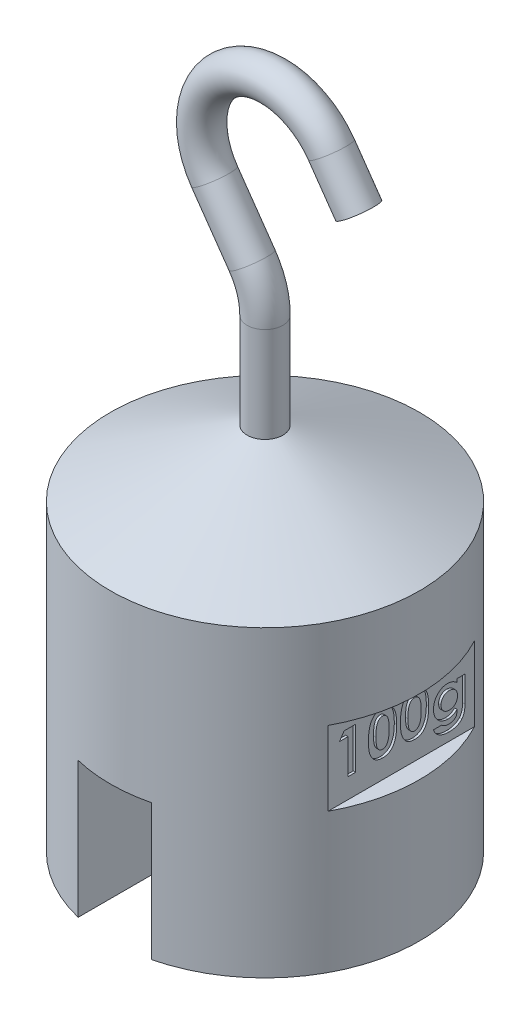
from build123d import *

# Parameters (mm, degrees)
SKETCH1_R               = 13
BOSS_EXTRUDE1_DEPTH     = 25.5
CUT_EXTRUDE1_DEPTH      = 32.436443819
CUT_EXTRUDE1_DEPTH_BACK = 32.436443819
SKETCH3_W               = 6.16
SKETCH3_H               = 11.43
SKETCH4_R               = 1.525
BOSS_EXTRUDE2_DEPTH     = 4.15
SWEEP1_START            = -20.06554348
SWEEP1_OUTLINE_R        = 1.5
SWEEP1_DEPTH            = 4.0000001
SWEEP1_START_2          = -16.06554338
SWEEP1_2_OUTLINE_R      = 1.5
SWEEP1_2_DEPTH          = 1.5
SWEEP1_3_OUTLINE_R      = 1.5
SWEEP1_3_ANGLE          = 35
SWEEP1_4_OUTLINE_R      = 1.5
SWEEP1_4_ANGLE          = 180
SWEEP1_START_3          = 5
SWEEP1_5_OUTLINE_R      = 1.5
SWEEP1_5_DEPTH          = 8.5800001
CUT_EXTRUDE4_DEPTH      = 38.312028765
CUT_EXTRUDE4_DEPTH_BACK = 38.312028765
SKETCH6_W               = 1.55
SKETCH6_H               = 6.25
CUT_EXTRUDE5_DEPTH      = 0.2


with BuildPart() as part:
    # Sketch1 → Boss-Extrude1 (new body)
    with BuildSketch(Plane(origin=(0, 0, 0), x_dir=(1, 0, 0), z_dir=(0, 1, 0))):
        with Locations(Location((0, 0, 0), (0, 0, 270))):
            Circle(SKETCH1_R)
    extrude(amount=-BOSS_EXTRUDE1_DEPTH)

    # Sketch2 → Revolve2 (revolve)
    with BuildSketch(Plane.XY, mode=Mode.PRIVATE) as revolve2_sk:
        Polygon((-1.5, 5.58), (-13, 0), (0, 0), (0, 5.58), align=None)
    revolve(revolve2_sk.sketch.rotate(Axis((0, 16.429455781, 0), (0, -1, 0)), 90), axis=Axis((0, 16.429455781, 0), (0, -1, 0)))

    # Sketch3 → Cut-Extrude1 (cut, two sides: drawn at the far end of the back side and taken through both)
    with BuildSketch(Plane.XY.offset(-CUT_EXTRUDE1_DEPTH_BACK)):
        with Locations((0, -19.785)):
            Rectangle(SKETCH3_W, SKETCH3_H)
    extrude(amount=CUT_EXTRUDE1_DEPTH + CUT_EXTRUDE1_DEPTH_BACK, mode=Mode.SUBTRACT)

    # Sketch4 → Boss-Extrude2 (add, symmetric)
    with BuildSketch(Plane(origin=(0, 0, 0), x_dir=(0, 0, -1), z_dir=(1, 0, 0))):
        with Locations(Location((0, -21.235, 0), (0, 0, 180))):
            Circle(SKETCH4_R)
    extrude(amount=BOSS_EXTRUDE2_DEPTH, both=True)



with BuildPart() as body_2:
    # Sweep1: read off the stored shape, not the designer's step
    # Sweep1 outline → Sweep1 (new body)
    with BuildSketch(Plane(origin=(0, 0, 0), x_dir=(0.8191520442889926, 0.5735764363510448, 0), z_dir=(0.5735764363510448, -0.8191520442889927, 0)).offset(SWEEP1_START)):
        with Locations((8.87425574, 0)):
            Circle(SWEEP1_OUTLINE_R)
        with Locations((20.87425574, 0)):
            Circle(SWEEP1_OUTLINE_R)
    extrude(amount=SWEEP1_DEPTH)

    # Sweep1 2 outline → Sweep1 2 (add)
    with BuildSketch(Plane(origin=(0, 0, 0), x_dir=(0.8191520442889926, 0.5735764363510448, 0), z_dir=(0.5735764363510448, -0.8191520442889927, 0)).offset(SWEEP1_START_2)):
        with Locations((8.87425574, 0)):
            Circle(SWEEP1_2_OUTLINE_R)
    extrude(amount=SWEEP1_2_DEPTH)

    # Sweep1 3 outline → Sweep1 3 (revolve)
    with BuildSketch(Plane(origin=(-6, 13.58, 0), x_dir=(1, 0, 0), z_dir=(0, -1, 0))):
        with Locations((6, 0)):
            Circle(SWEEP1_3_OUTLINE_R)
    revolve(axis=Axis((-6, 13.58, 0), (0, 0, 1)), revolution_arc=SWEEP1_3_ANGLE)

    # Sweep1 4 outline → Sweep1 4 (revolve)
    with BuildSketch(Plane(origin=(0.675154132, 24.96825348, 0), x_dir=(0.819152044288995, 0.5735764363510415, 0), z_dir=(0.5735764363510415, -0.819152044288995, 0))):
        with Locations((6, 0)):
            Circle(SWEEP1_4_OUTLINE_R)
    revolve(axis=Axis((0.675154132, 24.96825348, 0), (0, 0, 1)), revolution_arc=SWEEP1_4_ANGLE)


with BuildPart() as part_1:
    add(part.part)

    add(body_2.part)  # Sweep1 5 merges body 2
    # Sweep1 5 outline → Sweep1 5 (add)
    with BuildSketch(Plane(origin=(0, 0, 0), x_dir=(1, 0, 0), z_dir=(0, 1, 0)).offset(SWEEP1_START_3)):
        Circle(SWEEP1_5_OUTLINE_R)
    extrude(amount=SWEEP1_5_DEPTH)

    # Sketch6 → Cut-Extrude4 (cut, two sides: drawn at the far end of the back side and taken through both)
    with BuildSketch(Plane.XY.offset(-CUT_EXTRUDE4_DEPTH_BACK)):
        with Locations((12.225, -10.625)):
            Rectangle(SKETCH6_W, SKETCH6_H)
    extrude(amount=CUT_EXTRUDE4_DEPTH + CUT_EXTRUDE4_DEPTH_BACK, mode=Mode.SUBTRACT)

    # Sketch9 → Cut-Extrude5 (cut)
    # profile 1 of 4: a face of its own
    with BuildSketch(Plane(origin=(11.45, 0, 0), x_dir=(0, 0, -1), z_dir=(1, 0, 0))):
        Polygon((-4.803827401, -8.573958386), (-3.832773716, -8.573958386), (-3.832773716, -12.073958386), (-4.460978844, -12.073958386), (-4.460978844, -9.157291719), (-5.178927562, -9.157291719), align=None)
    # profile 2 of 4: a face of its own
    with BuildSketch(Plane(origin=(11.45, 0, 0), x_dir=(0, 0, -1), z_dir=(1, 0, 0))):
        with BuildLine():
            add(Edge.make_bspline(
                [(-1.577264901, -8.484214796), (-1.546857166, -8.484666208), (-1.487067433, -8.485553803), (-1.399008412, -8.495167185), (-1.314183228, -8.509690323), (-1.232260033, -8.529945037), (-1.153828521, -8.556751429), (-1.07831785, -8.588838221), (-1.006626815, -8.62788843), (-0.937841127, -8.671997648), (-0.871987283, -8.721935536), (-0.810648032, -8.778867306), (-0.752703191, -8.841482956), (-0.699407051, -8.910729123), (-0.649579354, -8.985975939), (-0.603383824, -9.067235336), (-0.5611741, -9.154905025), (-0.522477112, -9.249143212), (-0.487874143, -9.351362487), (-0.458728106, -9.462735349), (-0.433730501, -9.583287233), (-0.412630759, -9.71331821), (-0.396682765, -9.853001122), (-0.385933495, -10.002243172), (-0.378556838, -10.160756642), (-0.377954806, -10.26949558), (-0.37764551, -10.32536063)],
                knots=[0, 0, 0, 0, 0.879237366, 1.728815576, 2.559023295, 3.367336655, 4.166867292, 4.954216142, 5.737608147, 6.525189134, 7.316157332, 8.124696809, 8.942788509, 9.781158001, 10.649253743, 11.551476218, 12.482711956, 13.461909668, 14.496590415, 15.601789533, 16.789733467, 18.056700938, 19.410929216, 20.8549011, 22.384193279, 24, 24, 24, 24], degree=3))
            add(Edge.make_bspline(
                [(-0.37764551, -10.32536063), (-0.377979776, -10.381924614), (-0.378629247, -10.491827421), (-0.385626845, -10.651790736), (-0.39767704, -10.802116372), (-0.4132082, -10.942788778), (-0.434481642, -11.073733667), (-0.459395799, -11.195290097), (-0.489001898, -11.307414008), (-0.524744677, -11.409852761), (-0.563207432, -11.504256451), (-0.605532617, -11.591755205), (-0.650982512, -11.672586017), (-0.698514632, -11.747968331), (-0.750734863, -11.815679915), (-0.8051015, -11.878023315), (-0.863981762, -11.932623793), (-0.924896564, -11.982295211), (-0.99007746, -12.025221284), (-1.058852258, -12.06276372), (-1.132447092, -12.093215095), (-1.209520454, -12.119700074), (-1.291386075, -12.138713432), (-1.376743121, -12.153799906), (-1.466555257, -12.162137617), (-1.527702976, -12.163171965), (-1.559035735, -12.163701976)],
                knots=[0, 0, 0, 0, 1.643780988, 3.193836972, 4.651895693, 6.025988579, 7.305620092, 8.505800249, 9.631074763, 10.672816429, 11.65661981, 12.592235626, 13.49536222, 14.350718032, 15.179365177, 15.97804903, 16.751647189, 17.51006938, 18.259804725, 19.016521909, 19.783502495, 20.571750527, 21.382245291, 22.22305063, 23.089471752, 24, 24, 24, 24], degree=3))
            add(Edge.make_bspline(
                [(-1.559035735, -12.163701976), (-1.590367648, -12.163161741), (-1.651746404, -12.162103429), (-1.741801401, -12.1538619), (-1.827610797, -12.138652316), (-1.910124106, -12.119554104), (-1.98876705, -12.093273696), (-2.063916718, -12.061911238), (-2.134995275, -12.024603048), (-2.202199526, -11.981576961), (-2.265300016, -11.932237882), (-2.325277328, -11.877113548), (-2.381998787, -11.816343685), (-2.434601519, -11.749247621), (-2.483947006, -11.676720947), (-2.529520651, -11.597935445), (-2.571295067, -11.513005825), (-2.610576964, -11.421813702), (-2.64470796, -11.322395816), (-2.675082962, -11.213864377), (-2.699965365, -11.095314686), (-2.719977458, -10.966784829), (-2.735955101, -10.828547101), (-2.747840632, -10.68053478), (-2.754877098, -10.522678924), (-2.755519759, -10.414176732), (-2.755850639, -10.358313354)],
                knots=[0, 0, 0, 0, 0.917216111, 1.796812873, 2.643793957, 3.46689424, 4.273913431, 5.068098542, 5.848489301, 6.620921603, 7.401012384, 8.190319798, 9.003608147, 9.831726257, 10.68377682, 11.569763213, 12.493818149, 13.453288342, 14.474581811, 15.568529029, 16.750744269, 18.018426408, 19.375425659, 20.823733699, 22.36466933, 24, 24, 24, 24], degree=3))
            add(Edge.make_bspline(
                [(-2.755850639, -10.358313354), (-2.755251281, -10.280695589), (-2.754094812, -10.130931111), (-2.739439192, -9.914564984), (-2.717928458, -9.71457198), (-2.686334286, -9.531286638), (-2.647268529, -9.364030121), (-2.597242793, -9.21390423), (-2.540292132, -9.078831634), (-2.491762852, -8.998813815), (-2.468390703, -8.960276495)],
                knots=[0, 0, 0, 0, 1.288568992, 2.486310467, 3.599230591, 4.627010532, 5.572937695, 6.447898582, 7.252493626, 8, 8, 8, 8], degree=3))
            add(Edge.make_bspline(
                [(-2.468390703, -8.960276495), (-2.441214681, -8.922417444), (-2.388080203, -8.848395538), (-2.295173083, -8.751218612), (-2.195356479, -8.668108147), (-2.086580215, -8.600945006), (-1.970564633, -8.547980148), (-1.846313679, -8.510571665), (-1.714286193, -8.488775739), (-1.623620715, -8.485757814), (-1.577264901, -8.484214796)],
                knots=[0, 0, 0, 0, 1.058512271, 2.069600068, 3.047294572, 4.004278952, 4.967380941, 5.939006123, 6.946246673, 8, 8, 8, 8], degree=3))
        make_face()
        with BuildLine():
            add(Edge.make_bspline(
                [(-1.561840222, -9.112419925), (-1.589329067, -9.113722841), (-1.643221795, -9.116277249), (-1.721422712, -9.137960571), (-1.795161294, -9.17145163), (-1.851252264, -9.211752883), (-1.893235796, -9.250386468), (-1.922569992, -9.285348605), (-1.9508582, -9.324363831), (-1.97584377, -9.369192701), (-1.99943667, -9.418224462), (-2.022494045, -9.471681688), (-2.041395038, -9.530877405), (-2.059964763, -9.594803501), (-2.076233574, -9.665227364), (-2.089863272, -9.74272463), (-2.102040208, -9.827799272), (-2.110533767, -9.920507014), (-2.118452312, -10.02075086), (-2.1241287, -10.128754115), (-2.126501856, -10.244487643), (-2.12725621, -10.324191605), (-2.12764551, -10.365324572)],
                knots=[0, 0, 0, 0, 1.076674018, 2.110852608, 3.161083442, 4.239746716, 4.804137807, 5.395870207, 6.026861976, 6.692161227, 7.405688833, 8.16177676, 8.973626916, 9.841385931, 10.773283133, 11.807421078, 12.927755683, 14.143907515, 15.458935494, 16.872852025, 18.386167141, 20, 20, 20, 20], degree=3))
            add(Edge.make_bspline(
                [(-2.12764551, -10.365324572), (-2.127004769, -10.418614319), (-2.125776099, -10.52080136), (-2.119340899, -10.667749883), (-2.106442077, -10.801484871), (-2.090398546, -10.922912697), (-2.067864751, -11.031245868), (-2.041938162, -11.127509316), (-2.00992113, -11.210475916), (-1.97291928, -11.281345552), (-1.931938064, -11.341634205), (-1.887451151, -11.392879831), (-1.840973162, -11.437256125), (-1.791053366, -11.473302442), (-1.737810858, -11.500926678), (-1.681690116, -11.52079645), (-1.622655473, -11.532959564), (-1.582229159, -11.534646197), (-1.561840222, -11.535496848)],
                knots=[0, 0, 0, 0, 1.771748488, 3.397459088, 4.888034009, 6.237357457, 7.467047327, 8.564189669, 9.548206622, 10.417051504, 11.216568818, 11.965764335, 12.669334354, 13.348544111, 14.005342236, 14.656555988, 15.322436492, 16, 16, 16, 16], degree=3))
            add(Edge.make_bspline(
                [(-1.561840222, -11.535496848), (-1.542150969, -11.534914769), (-1.503601859, -11.533775133), (-1.447388623, -11.522076917), (-1.394229393, -11.503058159), (-1.344284673, -11.476154791), (-1.297375818, -11.441943042), (-1.253732089, -11.400272571), (-1.213682639, -11.35072802), (-1.190349647, -11.313958637), (-1.1783266, -11.295012072)],
                knots=[0, 0, 0, 0, 0.992283464, 1.942767638, 2.88273346, 3.832339453, 4.79467288, 5.803907806, 6.868395428, 8, 8, 8, 8], degree=3))
            add(Edge.make_bspline(
                [(-1.1783266, -11.295012072), (-1.164171487, -11.269122197), (-1.134489363, -11.214833228), (-1.100141157, -11.123222619), (-1.071228752, -11.019900992), (-1.046344268, -10.904546801), (-1.029324799, -10.776705076), (-1.014667653, -10.637186471), (-1.007598147, -10.485288428), (-1.006448253, -10.380052916), (-1.005850639, -10.32536063)],
                knots=[0, 0, 0, 0, 0.710965849, 1.490837728, 2.352621235, 3.297892224, 4.334225155, 5.461620853, 6.680770821, 8, 8, 8, 8], degree=3))
            add(Edge.make_bspline(
                [(-1.005850639, -10.32536063), (-1.006081484, -10.270193588), (-1.006525823, -10.164006451), (-1.01467815, -10.011562323), (-1.026030888, -9.872329913), (-1.042636667, -9.74662007), (-1.064003019, -9.634127625), (-1.090337129, -9.534859932), (-1.121383086, -9.448621353), (-1.158199891, -9.375497881), (-1.198976789, -9.313352961), (-1.242262712, -9.260037439), (-1.28824069, -9.214517992), (-1.336833832, -9.176623322), (-1.389166843, -9.147668951), (-1.444240096, -9.127224771), (-1.502166494, -9.114856727), (-1.541680498, -9.113243155), (-1.561840222, -9.112419925)],
                knots=[0, 0, 0, 0, 1.793836731, 3.452829483, 4.963243077, 6.335886805, 7.574563692, 8.684454726, 9.672768357, 10.54971625, 11.340229787, 12.085688095, 12.778991901, 13.440269426, 14.083255152, 14.715733572, 15.344777694, 16, 16, 16, 16], degree=3))
        make_face(mode=Mode.SUBTRACT)
    # profile 3 of 4: a face of its own
    with BuildSketch(Plane(origin=(11.45, 0, 0), x_dir=(0, 0, -1), z_dir=(1, 0, 0))):
        with BuildLine():
            add(Edge.make_bspline(
                [(1.115042791, -8.484214796), (1.145450526, -8.484666208), (1.205240259, -8.485553803), (1.29329928, -8.495167185), (1.378124465, -8.509690323), (1.460047659, -8.529945037), (1.538479171, -8.556751429), (1.613989842, -8.588838221), (1.685680877, -8.62788843), (1.754466565, -8.671997648), (1.82032041, -8.721935536), (1.88165966, -8.778867306), (1.939604502, -8.841482956), (1.992900641, -8.910729123), (2.042728339, -8.985975939), (2.088923868, -9.067235336), (2.131133592, -9.154905025), (2.16983058, -9.249143212), (2.204433549, -9.351362487), (2.233579587, -9.462735349), (2.258577191, -9.583287233), (2.279676933, -9.71331821), (2.295624928, -9.853001122), (2.306374197, -10.002243172), (2.313750855, -10.160756642), (2.314352886, -10.26949558), (2.314662182, -10.32536063)],
                knots=[0, 0, 0, 0, 0.879237366, 1.728815576, 2.559023295, 3.367336655, 4.166867292, 4.954216142, 5.737608147, 6.525189134, 7.316157332, 8.124696809, 8.942788509, 9.781158001, 10.649253743, 11.551476218, 12.482711956, 13.461909668, 14.496590415, 15.601789533, 16.789733467, 18.056700938, 19.410929216, 20.8549011, 22.384193279, 24, 24, 24, 24], degree=3))
            add(Edge.make_bspline(
                [(2.314662182, -10.32536063), (2.314327917, -10.381924614), (2.313678445, -10.491827421), (2.306680847, -10.651790736), (2.294630652, -10.802116372), (2.279099492, -10.942788778), (2.257826051, -11.073733667), (2.232911894, -11.195290097), (2.203305795, -11.307414008), (2.167563015, -11.409852761), (2.129100261, -11.504256451), (2.086775075, -11.591755205), (2.041325181, -11.672586017), (1.993793061, -11.747968331), (1.941572829, -11.815679915), (1.887206193, -11.878023315), (1.82832593, -11.932623793), (1.767411128, -11.982295211), (1.702230232, -12.025221284), (1.633455434, -12.06276372), (1.5598606, -12.093215095), (1.482787238, -12.119700074), (1.400921617, -12.138713432), (1.315564571, -12.153799906), (1.225752436, -12.162137617), (1.164604716, -12.163171965), (1.133271958, -12.163701976)],
                knots=[0, 0, 0, 0, 1.643780988, 3.193836972, 4.651895693, 6.025988579, 7.305620092, 8.505800249, 9.631074763, 10.672816429, 11.65661981, 12.592235626, 13.49536222, 14.350718032, 15.179365177, 15.97804903, 16.751647189, 17.51006938, 18.259804725, 19.016521909, 19.783502495, 20.571750527, 21.382245291, 22.22305063, 23.089471752, 24, 24, 24, 24], degree=3))
            add(Edge.make_bspline(
                [(1.133271958, -12.163701976), (1.101940045, -12.163161741), (1.040561288, -12.162103429), (0.950506291, -12.1538619), (0.864696896, -12.138652316), (0.782183586, -12.119554104), (0.703540643, -12.093273696), (0.628390974, -12.061911238), (0.557312418, -12.024603048), (0.490108167, -11.981576961), (0.427007676, -11.932237882), (0.367030365, -11.877113548), (0.310308905, -11.816343685), (0.257706173, -11.749247621), (0.208360686, -11.676720947), (0.162787041, -11.597935445), (0.121012625, -11.513005825), (0.081730728, -11.421813702), (0.047599732, -11.322395816), (0.01722473, -11.213864377), (-0.007657672, -11.095314686), (-0.027669765, -10.966784829), (-0.043647409, -10.828547101), (-0.055532939, -10.68053478), (-0.062569406, -10.522678924), (-0.063212066, -10.414176732), (-0.063542946, -10.358313354)],
                knots=[0, 0, 0, 0, 0.917216111, 1.796812873, 2.643793957, 3.46689424, 4.273913431, 5.068098542, 5.848489301, 6.620921603, 7.401012384, 8.190319798, 9.003608147, 9.831726257, 10.68377682, 11.569763213, 12.493818149, 13.453288342, 14.474581811, 15.568529029, 16.750744269, 18.018426408, 19.375425659, 20.823733699, 22.36466933, 24, 24, 24, 24], degree=3))
            add(Edge.make_bspline(
                [(-0.063542946, -10.358313354), (-0.062943588, -10.280695589), (-0.06178712, -10.130931111), (-0.047131499, -9.914564984), (-0.025620766, -9.71457198), (0.005973406, -9.531286638), (0.045039163, -9.364030121), (0.095064899, -9.21390423), (0.15201556, -9.078831634), (0.20054484, -8.998813815), (0.22391699, -8.960276495)],
                knots=[0, 0, 0, 0, 1.288568992, 2.486310467, 3.599230591, 4.627010532, 5.572937695, 6.447898582, 7.252493626, 8, 8, 8, 8], degree=3))
            add(Edge.make_bspline(
                [(0.22391699, -8.960276495), (0.251093012, -8.922417444), (0.304227489, -8.848395538), (0.397134609, -8.751218612), (0.496951213, -8.668108147), (0.605727477, -8.600945006), (0.72174306, -8.547980148), (0.845994013, -8.510571665), (0.9780215, -8.488775739), (1.068686977, -8.485757814), (1.115042791, -8.484214796)],
                knots=[0, 0, 0, 0, 1.058512271, 2.069600068, 3.047294572, 4.004278952, 4.967380941, 5.939006123, 6.946246673, 8, 8, 8, 8], degree=3))
        make_face()
        with BuildLine():
            add(Edge.make_bspline(
                [(1.13046747, -9.112419925), (1.102978625, -9.113722841), (1.049085897, -9.116277249), (0.97088498, -9.137960571), (0.897146398, -9.17145163), (0.841055429, -9.211752883), (0.799071896, -9.250386468), (0.7697377, -9.285348605), (0.741449492, -9.324363831), (0.716463922, -9.369192701), (0.692871022, -9.418224462), (0.669813647, -9.471681688), (0.650912654, -9.530877405), (0.632342929, -9.594803501), (0.616074118, -9.665227364), (0.602444421, -9.74272463), (0.590267484, -9.827799272), (0.581773926, -9.920507014), (0.57385538, -10.02075086), (0.568178992, -10.128754115), (0.565805837, -10.244487643), (0.565051483, -10.324191605), (0.564662182, -10.365324572)],
                knots=[0, 0, 0, 0, 1.076674018, 2.110852608, 3.161083442, 4.239746716, 4.804137807, 5.395870207, 6.026861976, 6.692161227, 7.405688833, 8.16177676, 8.973626916, 9.841385931, 10.773283133, 11.807421078, 12.927755683, 14.143907515, 15.458935494, 16.872852025, 18.386167141, 20, 20, 20, 20], degree=3))
            add(Edge.make_bspline(
                [(0.564662182, -10.365324572), (0.565302924, -10.418614319), (0.566531594, -10.52080136), (0.572966793, -10.667749883), (0.585865615, -10.801484871), (0.601909146, -10.922912697), (0.624442941, -11.031245868), (0.65036953, -11.127509316), (0.682386562, -11.210475916), (0.719388412, -11.281345552), (0.760369628, -11.341634205), (0.804856541, -11.392879831), (0.851334531, -11.437256125), (0.901254326, -11.473302442), (0.954496834, -11.500926678), (1.010617577, -11.52079645), (1.069652219, -11.532959564), (1.110078533, -11.534646197), (1.13046747, -11.535496848)],
                knots=[0, 0, 0, 0, 1.771748488, 3.397459088, 4.888034009, 6.237357457, 7.467047327, 8.564189669, 9.548206622, 10.417051504, 11.216568818, 11.965764335, 12.669334354, 13.348544111, 14.005342236, 14.656555988, 15.322436492, 16, 16, 16, 16], degree=3))
            add(Edge.make_bspline(
                [(1.13046747, -11.535496848), (1.150156724, -11.534914769), (1.188705834, -11.533775133), (1.244919069, -11.522076917), (1.298078299, -11.503058159), (1.348023019, -11.476154791), (1.394931874, -11.441943042), (1.438575603, -11.400272571), (1.478625053, -11.35072802), (1.501958045, -11.313958637), (1.513981092, -11.295012072)],
                knots=[0, 0, 0, 0, 0.992283464, 1.942767638, 2.88273346, 3.832339453, 4.79467288, 5.803907806, 6.868395428, 8, 8, 8, 8], degree=3))
            add(Edge.make_bspline(
                [(1.513981092, -11.295012072), (1.528136205, -11.269122197), (1.55781833, -11.214833228), (1.592166535, -11.123222619), (1.62107894, -11.019900992), (1.645963424, -10.904546801), (1.662982893, -10.776705076), (1.677640039, -10.637186471), (1.684709545, -10.485288428), (1.685859439, -10.380052916), (1.686457054, -10.32536063)],
                knots=[0, 0, 0, 0, 0.710965849, 1.490837728, 2.352621235, 3.297892224, 4.334225155, 5.461620853, 6.680770821, 8, 8, 8, 8], degree=3))
            add(Edge.make_bspline(
                [(1.686457054, -10.32536063), (1.686226208, -10.270193588), (1.685781869, -10.164006451), (1.677629542, -10.011562323), (1.666276804, -9.872329913), (1.649671026, -9.74662007), (1.628304673, -9.634127625), (1.601970563, -9.534859932), (1.570924607, -9.448621353), (1.534107802, -9.375497881), (1.493330903, -9.313352961), (1.45004498, -9.260037439), (1.404067002, -9.214517992), (1.355473861, -9.176623322), (1.303140849, -9.147668951), (1.248067596, -9.127224771), (1.190141198, -9.114856727), (1.150627194, -9.113243155), (1.13046747, -9.112419925)],
                knots=[0, 0, 0, 0, 1.793836731, 3.452829483, 4.963243077, 6.335886805, 7.574563692, 8.684454726, 9.672768357, 10.54971625, 11.340229787, 12.085688095, 12.778991901, 13.440269426, 14.083255152, 14.715733572, 15.344777694, 16, 16, 16, 16], degree=3))
        make_face(mode=Mode.SUBTRACT)
    # profile 4 of 4: a face of its own
    with BuildSketch(Plane(origin=(11.45, 0, 0), x_dir=(0, 0, -1), z_dir=(1, 0, 0))):
        with BuildLine():
            Line((4.69286731, -9.516266078), (5.365944233, -9.516266078))
            Line((5.365944233, -9.516266078), (5.365944233, -11.698157104))
            add(Edge.make_bspline(
                [(5.365944233, -11.698157104), (5.36513537, -11.750297351), (5.363573424, -11.850982214), (5.35165845, -11.996900588), (5.331788696, -12.132174947), (5.303196821, -12.256996871), (5.26626904, -12.37090758), (5.221104963, -12.474285771), (5.16862287, -12.567685832), (5.125470907, -12.62226173), (5.104425804, -12.648878258)],
                knots=[0, 0, 0, 0, 1.243822755, 2.401870584, 3.490053692, 4.503076575, 5.453444971, 6.342269266, 7.191528908, 8, 8, 8, 8], degree=3))
            add(Edge.make_bspline(
                [(5.104425804, -12.648878258), (5.074204745, -12.682027313), (5.01391563, -12.748157598), (4.90762254, -12.831611677), (4.791174544, -12.902938379), (4.663383272, -12.96139403), (4.524400935, -13.005918588), (4.374584567, -13.037984204), (4.213839189, -13.057956181), (4.102816657, -13.060057455), (4.045731893, -13.061137873)],
                knots=[0, 0, 0, 0, 0.916003385, 1.827369254, 2.751972866, 3.703651841, 4.69362366, 5.730423306, 6.83304546, 8, 8, 8, 8], degree=3))
            add(Edge.make_bspline(
                [(4.045731893, -13.061137873), (3.985389996, -13.060203708), (3.86933699, -13.058407067), (3.702571213, -13.040831805), (3.550663659, -13.011912924), (3.412900974, -12.971199238), (3.287999694, -12.918666808), (3.173604497, -12.855677394), (3.069935075, -12.780368365), (2.975424418, -12.695708671), (2.892264405, -12.599839143), (2.821253912, -12.493637532), (2.760756664, -12.378080681), (2.73088546, -12.295444314), (2.715703849, -12.253445566)],
                knots=[0, 0, 0, 0, 1.29412125, 2.488928388, 3.592140377, 4.607309753, 5.564519828, 6.493640275, 7.402258018, 8.307438948, 9.210158992, 10.116782752, 11.042881838, 12, 12, 12, 12], degree=3))
            Line((2.715703849, -12.253445566), (3.414021156, -12.253445566))
            add(Edge.make_bspline(
                [(3.414021156, -12.253445566), (3.430158523, -12.271211268), (3.46263833, -12.30696844), (3.520086259, -12.352341869), (3.583636689, -12.391179313), (3.653802342, -12.42298092), (3.730875779, -12.447163191), (3.814332349, -12.465535223), (3.904545871, -12.475888824), (3.966713031, -12.477152952), (3.998756733, -12.47780454)],
                knots=[0, 0, 0, 0, 0.888971165, 1.789239437, 2.70354581, 3.646217955, 4.638595249, 5.694475788, 6.811630907, 8, 8, 8, 8], degree=3))
            add(Edge.make_bspline(
                [(3.998756733, -12.47780454), (4.039251547, -12.477047917), (4.116593092, -12.475602835), (4.226014318, -12.459802426), (4.323729618, -12.436197539), (4.408328424, -12.400672761), (4.481315934, -12.358002614), (4.542205291, -12.30843569), (4.592482191, -12.253839434), (4.625368544, -12.202477696), (4.644910839, -12.155884272), (4.658217976, -12.115651521), (4.668323559, -12.069275974), (4.677522306, -12.017625612), (4.684398519, -11.960035007), (4.688954098, -11.896626165), (4.692904468, -11.827678451), (4.69287997, -11.779727434), (4.69286731, -11.754947969)],
                knots=[0, 0, 0, 0, 1.656375485, 3.163532, 4.516250129, 5.759907703, 6.905105653, 7.965920022, 8.961443813, 9.932912751, 10.442911961, 11.026787936, 11.664959534, 12.383728702, 13.174001396, 14.037595414, 14.985895623, 16, 16, 16, 16], degree=3))
            add(Edge.make_bspline(
                [(4.69286731, -11.754947969), (4.665345835, -11.781940641), (4.611640611, -11.834613959), (4.524458572, -11.901813773), (4.435212316, -11.957319165), (4.34338896, -12.001443521), (4.247162346, -12.033763833), (4.1459673, -12.056976462), (4.038651336, -12.071120287), (3.964912428, -12.072998755), (3.92724231, -12.073958386)],
                knots=[0, 0, 0, 0, 1.082007397, 2.111422008, 3.08419067, 4.02964304, 4.965866572, 5.929243163, 6.942137121, 8, 8, 8, 8], degree=3))
            add(Edge.make_bspline(
                [(3.92724231, -12.073958386), (3.885574776, -12.072995787), (3.803724962, -12.071104901), (3.683504429, -12.052729188), (3.568163519, -12.02413837), (3.457391652, -11.984337277), (3.352319134, -11.931495505), (3.251450743, -11.868628536), (3.156655866, -11.792435275), (3.066626695, -11.707169078), (2.985256258, -11.612391969), (2.913655307, -11.510601483), (2.853293908, -11.402499767), (2.804206233, -11.288187314), (2.765095904, -11.168144003), (2.738179672, -11.041719947), (2.721731763, -10.909128609), (2.719597097, -10.81876514), (2.718508336, -10.772676335)],
                knots=[0, 0, 0, 0, 1.007560175, 1.979205489, 2.935124557, 3.879618859, 4.820364716, 5.775815361, 6.749909327, 7.75781854, 8.772289371, 9.766897274, 10.764314289, 11.762244114, 12.772609037, 13.814079916, 14.885097635, 16, 16, 16, 16], degree=3))
            add(Edge.make_bspline(
                [(2.718508336, -10.772676335), (2.719459261, -10.723539425), (2.721317725, -10.627507459), (2.739535975, -10.487240509), (2.767884455, -10.35402564), (2.808352655, -10.228141508), (2.861518788, -10.110126261), (2.925767932, -9.999605427), (3.000494009, -9.895315156), (3.059645942, -9.833446312), (3.089401765, -9.802323771)],
                knots=[0, 0, 0, 0, 1.104124469, 2.157873671, 3.173961494, 4.162551312, 5.124378318, 6.07778831, 7.033049473, 8, 8, 8, 8], degree=3))
            add(Edge.make_bspline(
                [(3.089401765, -9.802323771), (3.117639613, -9.775786308), (3.173283702, -9.723492912), (3.264372902, -9.656391806), (3.358711381, -9.598839104), (3.457593095, -9.552544444), (3.560318357, -9.515677912), (3.667495309, -9.489886846), (3.77859104, -9.47398467), (3.854038555, -9.47226419), (3.89218622, -9.471394283)],
                knots=[0, 0, 0, 0, 1.042068658, 2.053448347, 3.038272799, 4.011764631, 4.986555969, 5.970496305, 6.973845226, 8, 8, 8, 8], degree=3))
            add(Edge.make_bspline(
                [(3.89218622, -9.471394283), (3.927983487, -9.472399458), (3.998918038, -9.474391276), (4.104012223, -9.48844439), (4.205777633, -9.513271257), (4.305328527, -9.547402978), (4.403720064, -9.591616737), (4.500867218, -9.649567385), (4.598739618, -9.718859982), (4.660843075, -9.773002451), (4.69286731, -9.800921527)],
                knots=[0, 0, 0, 0, 0.968122651, 1.918396369, 2.861262201, 3.796768263, 4.761417965, 5.77287463, 6.85156174, 8, 8, 8, 8], degree=3))
            Line((4.69286731, -9.800921527), (4.69286731, -9.516266078))
        make_face()
        with BuildLine():
            add(Edge.make_bspline(
                [(4.042226284, -10.054727617), (4.017666418, -10.055519019), (3.96931437, -10.057077086), (3.898252123, -10.065855388), (3.830813723, -10.082425278), (3.766177254, -10.103940699), (3.705128582, -10.132883202), (3.647549692, -10.168195373), (3.592758091, -10.20918306), (3.542497277, -10.256619713), (3.495908949, -10.307876102), (3.456791763, -10.36428668), (3.421931377, -10.422639337), (3.394822256, -10.485282155), (3.37240539, -10.550515141), (3.358705127, -10.619665753), (3.347758194, -10.69147005), (3.34706623, -10.740612223), (3.346713464, -10.765665117)],
                knots=[0, 0, 0, 0, 1.059154978, 2.085203149, 3.079850876, 4.048488546, 5.017545358, 5.985239295, 6.956545898, 7.961752598, 8.960830395, 9.936516972, 10.916356752, 11.886198968, 12.873933111, 13.883774911, 14.921139228, 16, 16, 16, 16], degree=3))
            add(Edge.make_bspline(
                [(3.346713464, -10.765665117), (3.347095319, -10.791645317), (3.347844757, -10.842634662), (3.358337574, -10.916916612), (3.373326408, -10.988008909), (3.395968276, -11.055043742), (3.424313805, -11.118901911), (3.458363364, -11.179552037), (3.500395642, -11.235544003), (3.547071053, -11.288110029), (3.598706669, -11.33563573), (3.654287841, -11.376972878), (3.712670256, -11.41267176), (3.77511595, -11.440505551), (3.840273792, -11.463060575), (3.908797303, -11.47944003), (3.980529012, -11.488289757), (4.029350114, -11.489838485), (4.054145355, -11.490625053)],
                knots=[0, 0, 0, 0, 1.097915424, 2.154794285, 3.166904039, 4.167166757, 5.140698173, 6.119085138, 7.101657521, 8.095747232, 9.089148684, 10.06378348, 11.021581144, 11.977080764, 12.949256321, 13.934658686, 14.951055324, 16, 16, 16, 16], degree=3))
            add(Edge.make_bspline(
                [(4.054145355, -11.490625053), (4.078491301, -11.490243328), (4.126226007, -11.489494885), (4.195857445, -11.478995707), (4.262384554, -11.463814783), (4.325687521, -11.442106025), (4.385415028, -11.413771383), (4.442368549, -11.379958285), (4.495339989, -11.33904059), (4.545333959, -11.29278032), (4.590450327, -11.241340124), (4.630272976, -11.185605347), (4.66298584, -11.125565924), (4.690850508, -11.062172407), (4.711481566, -10.994530557), (4.727146316, -10.923312068), (4.736335168, -10.848171927), (4.737265085, -10.796773174), (4.737739105, -10.770572969)],
                knots=[0, 0, 0, 0, 1.047368431, 2.053558439, 3.025081491, 3.983010266, 4.928381778, 5.867249904, 6.829345556, 7.804873619, 8.796055618, 9.770545002, 10.747991713, 11.735078325, 12.747239243, 13.787476531, 14.872179528, 16, 16, 16, 16], degree=3))
            add(Edge.make_bspline(
                [(4.737739105, -10.770572969), (4.737279219, -10.744604192), (4.736381268, -10.693898851), (4.727062657, -10.619713442), (4.711534043, -10.549388287), (4.690617211, -10.482342987), (4.663357898, -10.418977923), (4.629174839, -10.359882849), (4.590085058, -10.30396655), (4.544058198, -10.253133683), (4.494448064, -10.206118042), (4.439754128, -10.166343814), (4.38271166, -10.131200742), (4.321394686, -10.103340557), (4.25656483, -10.081397159), (4.188117966, -10.066386626), (4.116403173, -10.055853516), (4.06727304, -10.055107791), (4.042226284, -10.054727617)],
                knots=[0, 0, 0, 0, 1.111098411, 2.169475416, 3.193737863, 4.190319778, 5.171520483, 6.139320596, 7.107999188, 8.085777416, 9.069626166, 10.027970922, 10.974971434, 11.932846196, 12.904000912, 13.89897495, 14.928888274, 16, 16, 16, 16], degree=3))
        make_face(mode=Mode.SUBTRACT)
    extrude(amount=-CUT_EXTRUDE5_DEPTH, mode=Mode.SUBTRACT)


solid = part_1.part
